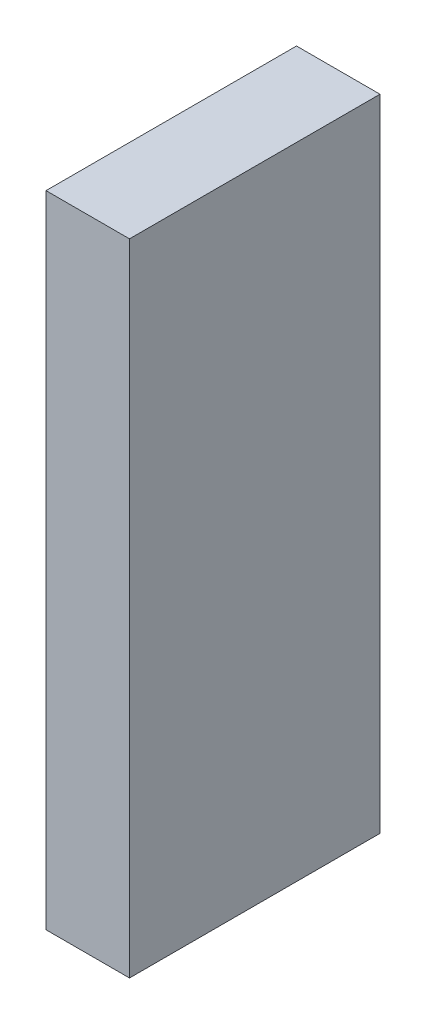
from build123d import *

# Parameters (mm, degrees)
SKETCH1_W           = 30
SKETCH1_H           = 90
BOSS_EXTRUDE1_DEPTH = 115


with BuildPart() as part:
    # Sketch1 → Boss-Extrude1 (new, symmetric)
    with BuildSketch(Plane(origin=(0, 0, 0), x_dir=(1, 0, 0), z_dir=(0, 1, 0))):
        Rectangle(SKETCH1_W, SKETCH1_H)
    extrude(amount=BOSS_EXTRUDE1_DEPTH, both=True)


solid = part.part
